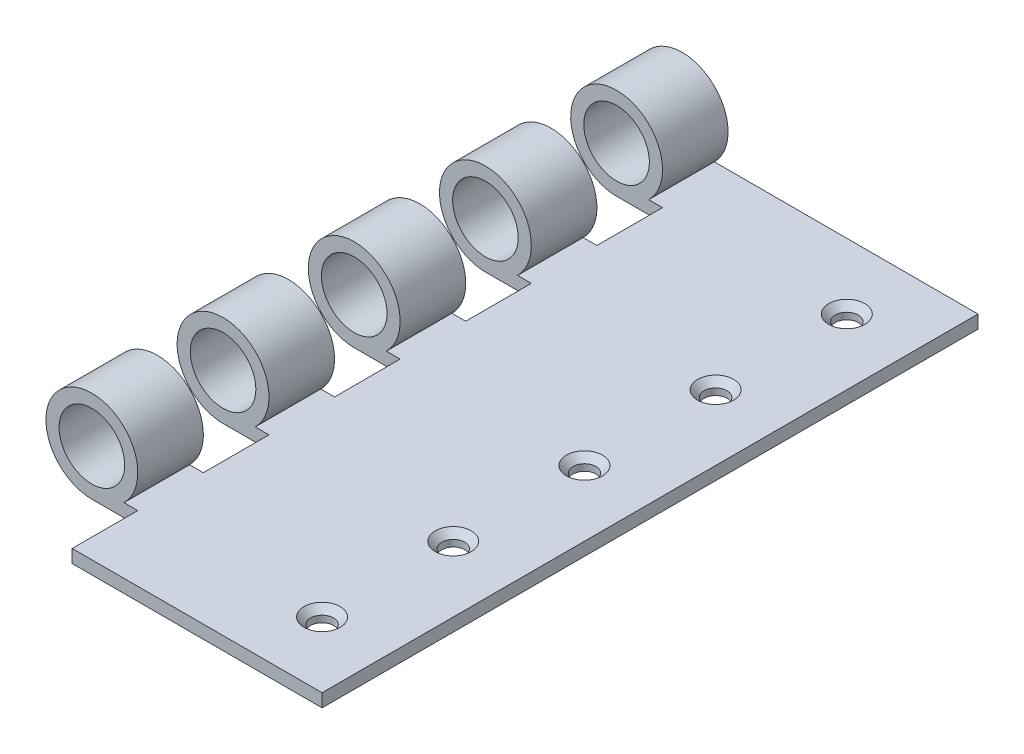
from build123d import *

# Parameters (mm, degrees)
SKETCH1_W           = 50
SKETCH1_H           = 100
BOSS_EXTRUDE1_DEPTH = 2
SKETCH2_R           = 7
BOSS_EXTRUDE2_DEPTH = 100
SKETCH3_R           = 5
CUT_EXTRUDE1_DEPTH  = 114.624453084
FILLET3_R           = 7
SKETCH6_W           = 50
SKETCH6_H           = 10
CUT_EXTRUDE3_DEPTH  = 114.395398225
LPATTERN1_COUNT     = 5
LPATTERN1_PITCH     = 20
SKETCH7_R           = 1.75
CUT_EXTRUDE4_DEPTH  = 114.395398225
CHAMFER2_SIZE       = 1
LPATTERN3_COUNT     = 5
LPATTERN3_PITCH     = 20
CHAMFER3_SIZE       = 1


with BuildPart() as part:
    # Sketch1 → Boss-Extrude1 (new body)
    with BuildSketch(Plane(origin=(0, 0, 0), x_dir=(1, 0, 0), z_dir=(0, 1, 0))):
        with Locations((-25, 50)):
            Rectangle(SKETCH1_W, SKETCH1_H)
    extrude(amount=BOSS_EXTRUDE1_DEPTH)

    # Sketch2 → Boss-Extrude2 (add)
    with BuildSketch(Plane(origin=(0, 0, -100), x_dir=(-1, 0, 0), z_dir=(0, 0, -1))):
        with Locations((45.101020514, 7)):
            Circle(SKETCH2_R)
    extrude(amount=-BOSS_EXTRUDE2_DEPTH)

    # Sketch3 → Cut-Extrude1 (cut, through all)
    with BuildSketch(Plane(origin=(0, 0, -100), x_dir=(-1, 0, 0), z_dir=(0, 0, -1))):
        with Locations((45.101020514, 7)):
            Circle(SKETCH3_R)
    extrude(amount=-CUT_EXTRUDE1_DEPTH, mode=Mode.SUBTRACT)

    # Fillet3
    # the kernel refuses this fillet: 7 mm, written as the material it takes off along each edge
    with BuildSketch(Plane(origin=(-50, 0, 12.247448714), x_dir=(1, 0, 0), z_dir=(0, 0, -1))) as fillet3_piece_1:
        with BuildLine():
            CenterArc((4.898979486, -7), FILLET3_R, 90, 44.415308597)
            Line((0, -2), (-0.09797959, -1.9))
            ThreePointArc((-0.09797959, -1.9), (-0.14, -1), (-0.14, 0))
            Line((-0.14, 0), (0, 0.14))
            Line((0, 0.14), (4.898979486, 0.14))
            Line((4.898979486, 0.14), (4.898979486, 0))
        make_face()
    extrude(amount=124.494897428, mode=Mode.SUBTRACT)

    # Sketch6 → Cut-Extrude3 (cut, symmetric)
    with BuildSketch(Plane(origin=(0, 2, 0), x_dir=(1, 0, 0), z_dir=(0, 1, 0))):
        with Locations((-63.101020514, 85)):
            Rectangle(SKETCH6_W, SKETCH6_H)
    cut_extrude3 = extrude(amount=CUT_EXTRUDE3_DEPTH, both=True, mode=Mode.SUBTRACT)

    # LPattern1: Cut-Extrude3 ×5
    with Locations(*[(0, 0, i * LPATTERN1_PITCH) for i in range(1, LPATTERN1_COUNT)]):
        add(cut_extrude3, mode=Mode.SUBTRACT)

    # Sketch7 → Cut-Extrude4 (cut, symmetric)
    with BuildSketch(Plane(origin=(0, 2, 0), x_dir=(1, 0, 0), z_dir=(0, 1, 0))):
        with Locations(Location((-10, 90, 0), (0, 0, 270))):
            Circle(SKETCH7_R)
    cut_extrude4 = extrude(amount=CUT_EXTRUDE4_DEPTH, both=True, mode=Mode.SUBTRACT)

    # Chamfer2
    chamfer2_edges = [part.edges().sort_by_distance(p)[0] for p in [
        (-10, 2, -91.75),
    ]]
    chamfer(chamfer2_edges, length=CHAMFER2_SIZE)

    # LPattern3: Cut-Extrude4 ×5
    with Locations(*[(0, 0, i * LPATTERN3_PITCH) for i in range(1, LPATTERN3_COUNT)]):
        add(cut_extrude4, mode=Mode.SUBTRACT)

    # Chamfer3
    chamfer3_edges = [part.edges().sort_by_distance(p)[0] for p in [
        (-10, 2, -71.75),
        (-10, 2, -51.75),
        (-10, 2, -31.75),
        (-10, 2, -11.75),
    ]]
    chamfer(chamfer3_edges, length=CHAMFER3_SIZE)


solid = part.part
